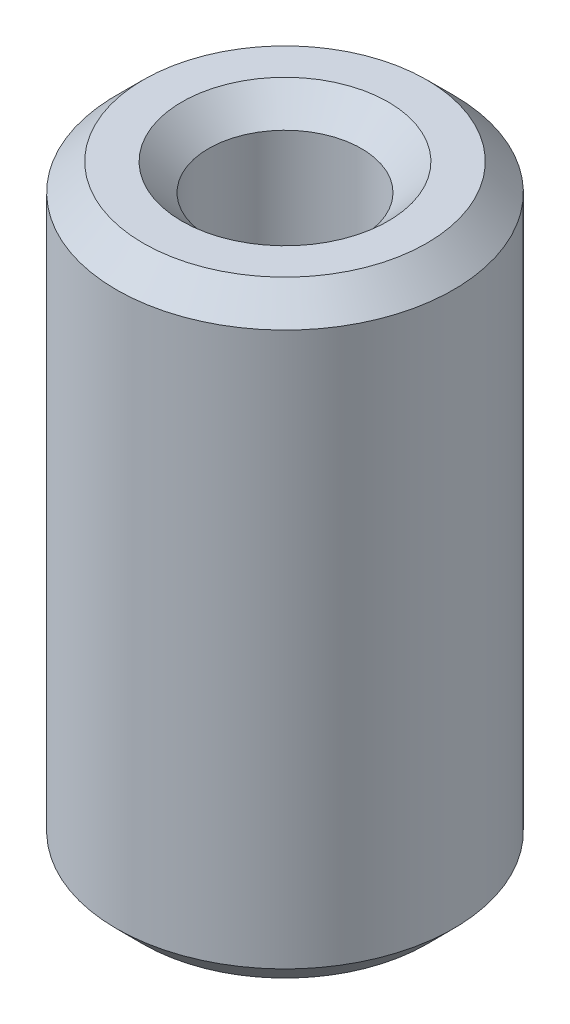
from build123d import *
from OCP.BRepFilletAPI import BRepFilletAPI_MakeChamfer

# Parameters (mm, degrees)
SKETCH1_R           = 22.5
BOSS_EXTRUDE1_DEPTH = 81.030915537
SKETCH2_R           = 10.199174828
CUT_EXTRUDE1_DEPTH  = 88.054633839
CHAMFER1_SIZE       = 3.580234487
CHAMFER1_SIZE2      = 3.590256796


with BuildPart() as part:
    # Sketch1 → Boss-Extrude1 (new body)
    with BuildSketch(Plane(origin=(0, 0, 0), x_dir=(1, 0, 0), z_dir=(0, 1, 0))):
        Circle(SKETCH1_R)
    extrude(amount=BOSS_EXTRUDE1_DEPTH)

    # Sketch2 → Cut-Extrude1 (cut, through all)
    with BuildSketch(Plane(origin=(0, 0, 0), x_dir=(1, 0, 0), z_dir=(0, 1, 0))):
        Circle(SKETCH2_R)
    extrude(amount=CUT_EXTRUDE1_DEPTH, mode=Mode.SUBTRACT)

    # Chamfer1: one chamfer whose edges measure the first distance from different faces: ONE call of the kernel's chamfer builder (chamfer() names one face for all edges)
    chamfer1_edges_1 = [part.edges().sort_by_distance(p)[0] for p in [
        (-10.199174828, 81.030915537, 0),
    ]]
    chamfer1_side_1 = [part.faces().sort_by_distance(p)[0] for p in [
        (-21.863603897, 81.030915537, 0),
    ]]
    chamfer1_edges_2 = [part.edges().sort_by_distance(p)[0] for p in [
        (-10.199174828, 0, 0),
    ]]
    chamfer1_side_2 = [part.faces().sort_by_distance(p)[0] for p in [
        (-10.199174828, 40.515457769, 0),
    ]]
    chamfer1_edges_3 = [part.edges().sort_by_distance(p)[0] for p in [
        (-22.5, 0, 0),
    ]]
    chamfer1_side_3 = [part.faces().sort_by_distance(p)[0] for p in [
        (-21.863603897, 0, 0),
    ]]
    chamfer1_edges_4 = [part.edges().sort_by_distance(p)[0] for p in [
        (-22.5, 81.030915537, 0),
    ]]
    chamfer1_side_4 = [part.faces().sort_by_distance(p)[0] for p in [
        (-22.5, 40.515457769, 0),
    ]]
    chamfer1 = BRepFilletAPI_MakeChamfer(part.part.solid().wrapped)
    for e in chamfer1_edges_1:
        chamfer1.Add(CHAMFER1_SIZE, CHAMFER1_SIZE2, e.wrapped, chamfer1_side_1[0].wrapped)  # the first distance lies on this face
    for e in chamfer1_edges_2:
        chamfer1.Add(CHAMFER1_SIZE, CHAMFER1_SIZE2, e.wrapped, chamfer1_side_2[0].wrapped)  # the first distance lies on this face
    for e in chamfer1_edges_3:
        chamfer1.Add(CHAMFER1_SIZE, CHAMFER1_SIZE2, e.wrapped, chamfer1_side_3[0].wrapped)  # the first distance lies on this face
    for e in chamfer1_edges_4:
        chamfer1.Add(CHAMFER1_SIZE, CHAMFER1_SIZE2, e.wrapped, chamfer1_side_4[0].wrapped)  # the first distance lies on this face
    add(Compound.cast(chamfer1.Shape()), mode=Mode.REPLACE)


solid = part.part
